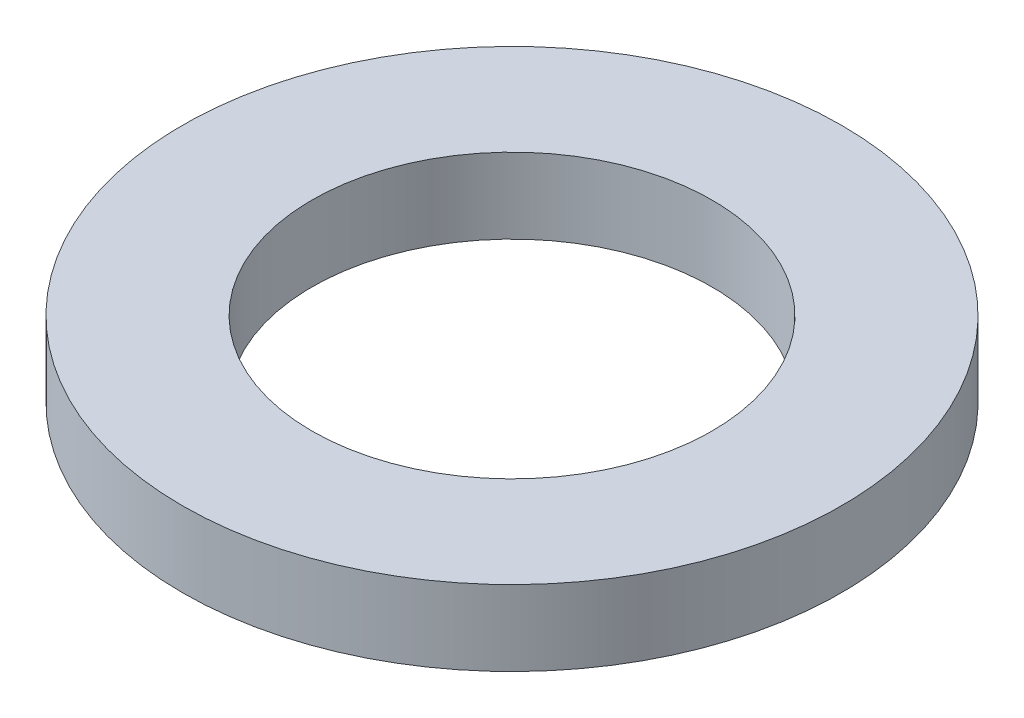
from build123d import *

# Parameters (mm, degrees)
SKETCH1_R           = 70
BOSS_EXTRUDE1_DEPTH = 16
SKETCH2_R           = 42.5
CUT_EXTRUDE1_DEPTH  = 101.279609094


with BuildPart() as part:
    # Sketch1 → Boss-Extrude1 (new body)
    with BuildSketch(Plane(origin=(0, 0, 0), x_dir=(1, 0, 0), z_dir=(0, 1, 0))):
        Circle(SKETCH1_R)
    extrude(amount=BOSS_EXTRUDE1_DEPTH)

    # Sketch2 → Cut-Extrude1 (cut, through all)
    with BuildSketch(Plane(origin=(0, 0, 0), x_dir=(1, 0, 0), z_dir=(0, 1, 0))):
        Circle(SKETCH2_R)
    extrude(amount=CUT_EXTRUDE1_DEPTH, mode=Mode.SUBTRACT)


solid = part.part
